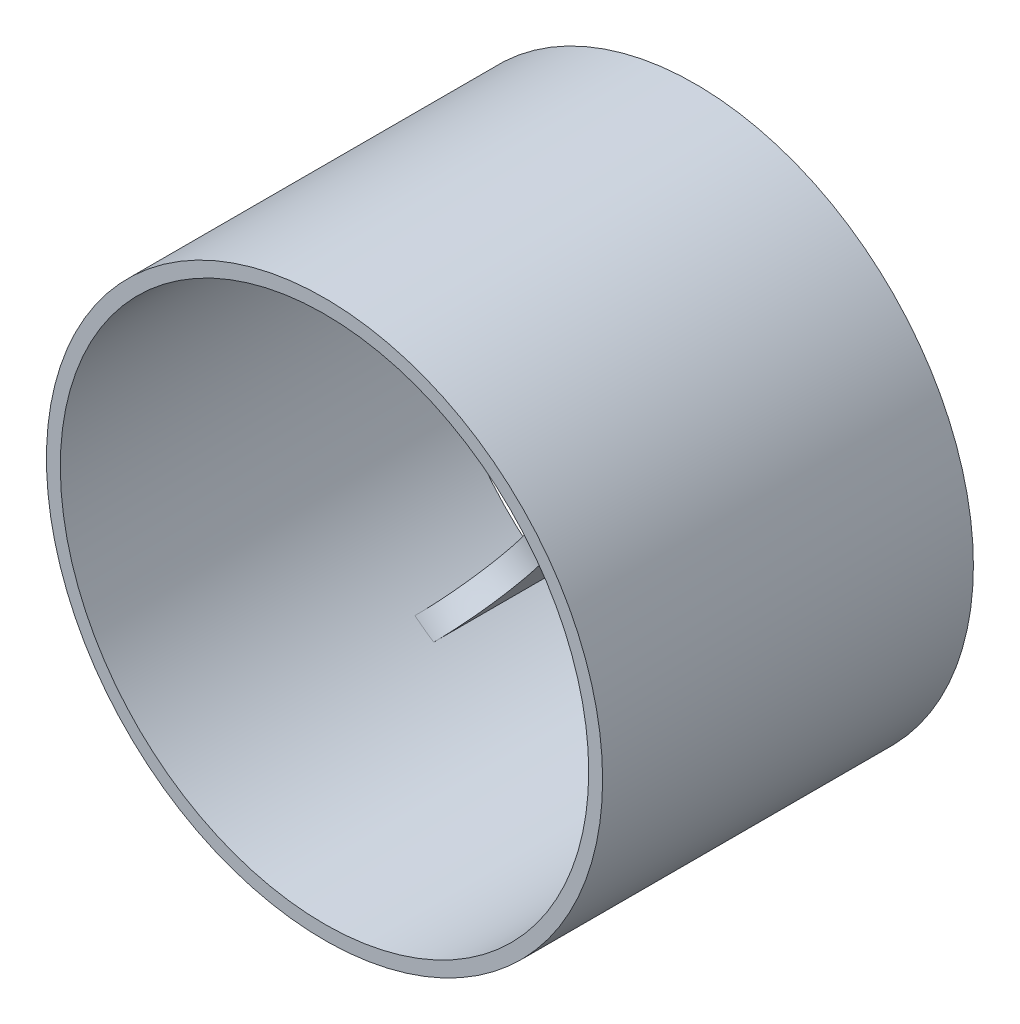
from build123d import *

# Parameters (mm, degrees)
SKETCH1_R                 = 60
BOSS_EXTRUDE1_DEPTH       = 80
CUT_EXTRUDE1_DEPTH        = 80
CIRPATTERN1_COUNT         = 5
F_5_0MM_DOWEL_HOLE1_D     = 5
F_5_0MM_DOWEL_HOLE1_DEPTH = 10
F_5_0MM_DOWEL_HOLE1_TIP   = 1.502151548


with BuildPart() as part:
    # Sketch1 → Boss-Extrude1 (new body)
    with BuildSketch(Plane.XY):
        Circle(SKETCH1_R)
    extrude(amount=BOSS_EXTRUDE1_DEPTH)

    # Sketch1<3> → Cut-Extrude1 (cut)
    with BuildSketch(Plane.XY):
        with BuildLine():
            Line((-2.5, 56.945149047), (-2.5, 9.682458366))
            ThreePointArc((-2.5, 9.682458366), (-5.877852523, 8.090169944), (-8.436022636, 5.369685473))
            Line((-8.436022636, 5.369685473), (-53.385512587, 19.974660094))
            ThreePointArc((-53.385512587, 19.974660094), (-33.503759381, 46.113968679), (-2.5, 56.945149047))
        make_face()
    cut_extrude1 = extrude(amount=CUT_EXTRUDE1_DEPTH, mode=Mode.SUBTRACT)

    # CirPattern1: Cut-Extrude1 ×5 about axis
    cirpattern1_axis = Axis((0, 0, 80), (0, 0, -1))
    for i in range(1, CIRPATTERN1_COUNT):
        add(cut_extrude1.rotate(cirpattern1_axis, i * 360 / CIRPATTERN1_COUNT), mode=Mode.SUBTRACT)

    # Sketch2 → Cut-Revolve1 (revolve, cut)
    with BuildSketch(Plane(origin=(0, 0, 0), x_dir=(0, 0, -1), z_dir=(1, 0, 0))):
        with BuildLine():
            Line((-80, 0), (-10, 0))
            Line((-10, 0), (-10, 42))
            ThreePointArc((-10, 42), (-14.393398282, 52.606601718), (-25, 57))
            Line((-25, 57), (-80, 57))
            Line((-80, 57), (-80, 0))
        make_face()
    revolve(axis=Axis((0, 0, 0), (0, 0, 1)), mode=Mode.SUBTRACT)

    # Ø5.0mm Dowel Hole1
    with Locations(Plane(origin=(0, 0, 0), x_dir=(-1, 0, 0), z_dir=(0, 0, -1))):
        with Locations((0, 0)):
            Hole(F_5_0MM_DOWEL_HOLE1_D / 2, depth=F_5_0MM_DOWEL_HOLE1_DEPTH)
            with Locations((0, 0, -(F_5_0MM_DOWEL_HOLE1_DEPTH + F_5_0MM_DOWEL_HOLE1_TIP / 2))):  # 118° drill point
                Cone(0, F_5_0MM_DOWEL_HOLE1_D / 2, F_5_0MM_DOWEL_HOLE1_TIP, mode=Mode.SUBTRACT)


solid = part.part
